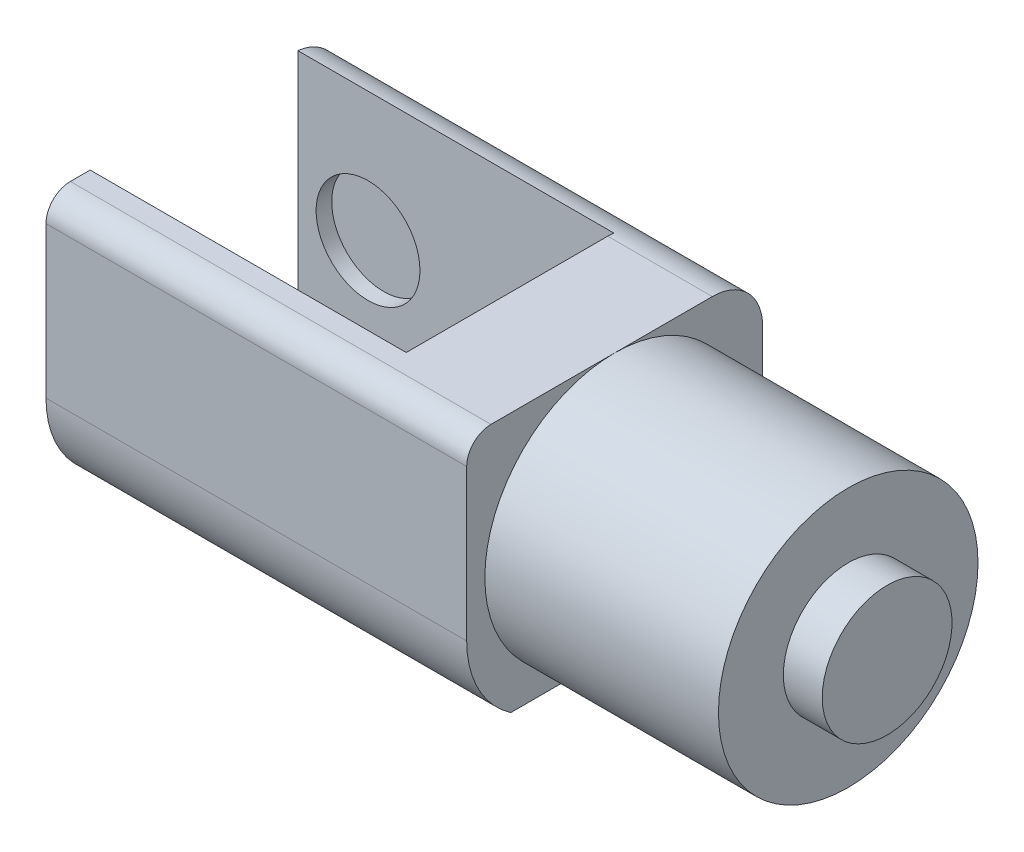
from build123d import *

# Parameters (mm, degrees)
SKETCH1_R            = 12.7
BOSS_EXTRUDE1_DEPTH  = 22.86
SKETCH2_R            = 6.35
BOSS_EXTRUDE2_DEPTH  = 3.81
SKETCH4_W            = 41.167859691
SKETCH4_H            = 25.4
BOSS_EXTRUDE4_DEPTH  = 4.318
FILLET3_R            = 2.380000066
FILLET4_R            = 10
SKETCH5_W            = 10.234607526
SKETCH5_H            = 25.4
BOSS_EXTRUDE5_DEPTH  = 20.32
SKETCH8_W            = 41.167859691
SKETCH8_H            = 25.4
BOSS_EXTRUDE10_DEPTH = 4.318
FILLET12_R           = 4.92
FILLET13_R           = 4.92
SKETCH9_R            = 5.08
CUT_EXTRUDE1_DEPTH   = 1.524
CUT_EXTRUDE3_START   = 1.524
SKETCH10_R           = 5.08
CUT_EXTRUDE3_DEPTH   = 1.524


with BuildPart() as part:
    # Sketch1 → Boss-Extrude1 (new body)
    with BuildSketch(Plane(origin=(0, 0, 0), x_dir=(0, 0, -1), z_dir=(1, 0, 0))):
        Circle(SKETCH1_R)
    extrude(amount=BOSS_EXTRUDE1_DEPTH)

    # Sketch2 → Boss-Extrude2 (add)
    with BuildSketch(Plane(origin=(22.86, 0, 0), x_dir=(0, 0, -1), z_dir=(1, 0, 0))):
        with Locations(Location((0, 0, 0), (0, 0, 180))):
            Circle(SKETCH2_R)
    extrude(amount=BOSS_EXTRUDE2_DEPTH)

    # Sketch4 → Boss-Extrude4 (add)
    with BuildSketch(Plane.XY.offset(10.16)):
        with Locations((-20.583929846, 0)):
            Rectangle(SKETCH4_W, SKETCH4_H)
    extrude(amount=BOSS_EXTRUDE4_DEPTH)

    # Fillet3
    fillet3_edges = [part.edges().sort_by_distance(p)[0] for p in [
        (-20.583929846, 12.7, 14.478),
    ]]
    fillet(fillet3_edges, radius=FILLET3_R)

    # Fillet4
    # the kernel refuses this fillet: 10 mm, written as the material it takes off along each edge
    with BuildSketch(Plane(origin=(-61.740121963, -12.7, 14.478), x_dir=(0, 1, 0), z_dir=(1, 0, 0))) as fillet4_piece_1:
        with BuildLine():
            CenterArc((8.228904909, -10), FILLET4_R, 90, 55.375198577)
            Line((0, -4.318), (-0.164578098, -4.20436))
            ThreePointArc((-0.164578098, -4.20436), (-0.2, -2.159), (-0.2, 0))
            Line((-0.2, 0), (0, 0.2))
            Line((0, 0.2), (8.228904909, 0.2))
            Line((8.228904909, 0.2), (8.228904909, 0))
        make_face()
    extrude(amount=82.312384236, mode=Mode.SUBTRACT)

    # Sketch5 → Boss-Extrude5 (add)
    with BuildSketch(Plane.XY.offset(10.16)):
        with Locations((-5.117303763, 0)):
            Rectangle(SKETCH5_W, SKETCH5_H)
    extrude(amount=-BOSS_EXTRUDE5_DEPTH)

    # Sketch8 → Boss-Extrude10 (add)
    with BuildSketch(Plane.XY.offset(-10.16)):
        with Locations((-20.583929846, 0)):
            Rectangle(SKETCH8_W, SKETCH8_H)
    extrude(amount=-BOSS_EXTRUDE10_DEPTH)

    # Fillet12
    fillet12_edges = [part.edges().sort_by_distance(p)[0] for p in [
        (-20.583929846, 12.7, -14.478),
    ]]
    fillet(fillet12_edges, radius=FILLET12_R)

    # Fillet13
    fillet13_edges = [part.edges().sort_by_distance(p)[0] for p in [
        (-20.583929846, -12.7, -14.478),
    ]]
    fillet(fillet13_edges, radius=FILLET13_R)

    # Sketch9 → Cut-Extrude1 (cut)
    with BuildSketch(Plane.XY.offset(-10.16)):
        with Locations((-34.29, 0)):
            Circle(SKETCH9_R)
    extrude(amount=-CUT_EXTRUDE1_DEPTH, mode=Mode.SUBTRACT)

    # Sketch10 → Cut-Extrude3 (cut)
    with BuildSketch(Plane.XY.offset(10.16).offset(CUT_EXTRUDE3_START)):
        with Locations((-34.29, 0)):
            Circle(SKETCH10_R)
    extrude(amount=-CUT_EXTRUDE3_DEPTH, mode=Mode.SUBTRACT)


solid = part.part
